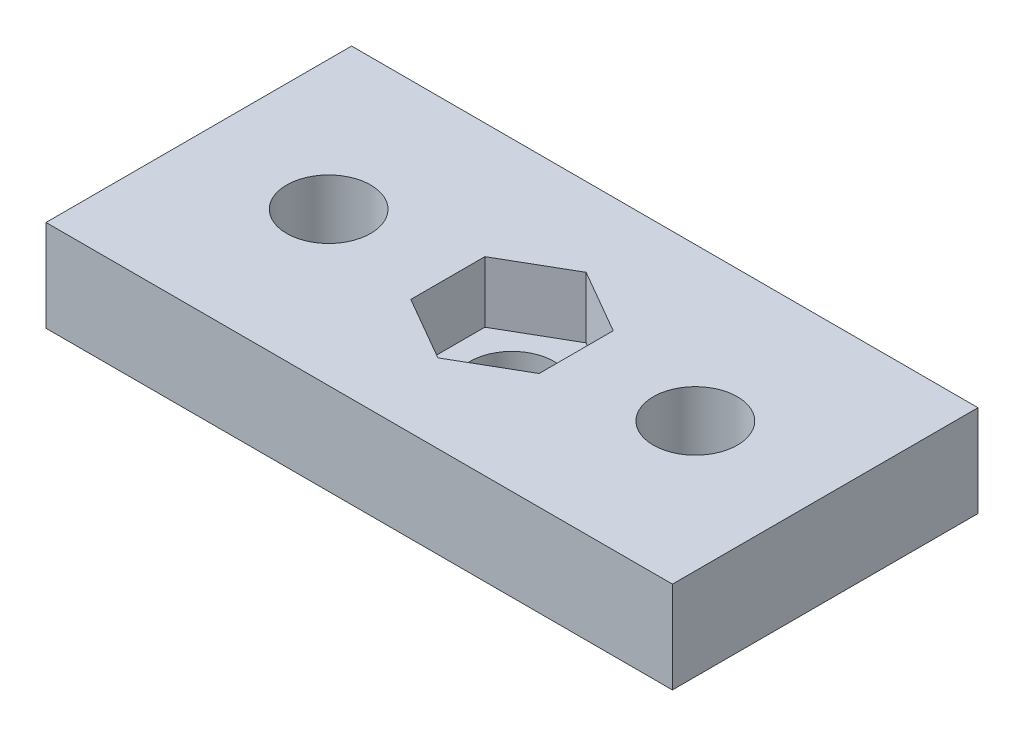
from build123d import *

# Parameters (mm, degrees)
SKETCH1_W           = 41
SKETCH1_H           = 20
BOSS_EXTRUDE1_DEPTH = 6
NUT_DEPTH           = 4
SKETCH7_R           = 2.75
HOLES_DEPTH         = 47.010868281


with BuildPart() as part:
    # Sketch1 → Boss-Extrude1 (new body)
    with BuildSketch(Plane(origin=(0, 0, 0), x_dir=(1, 0, 0), z_dir=(0, 1, 0))):
        with Locations((20.5, 10)):
            Rectangle(SKETCH1_W, SKETCH1_H)
    extrude(amount=-BOSS_EXTRUDE1_DEPTH)

    # Sketch2 → nut (cut)
    with BuildSketch(Plane(origin=(0, 0, 0), x_dir=(1, 0, 0), z_dir=(0, 1, 0))):
        Polygon((20.5, 5.150257739), (24.7, 7.575128869), (24.7, 12.424871131), (20.5, 14.849742261), (16.3, 12.424871131), (16.3, 7.575128869), align=None)
    extrude(amount=-NUT_DEPTH, mode=Mode.SUBTRACT)

    # Sketch7 → holes (cut, through all)
    with BuildSketch(Plane(origin=(0, 0, 0), x_dir=(1, 0, 0), z_dir=(0, 1, 0))):
        with Locations((8.5, 10)):
            Circle(SKETCH7_R)
        with Locations((32.5, 10)):
            Circle(SKETCH7_R)
        with Locations((20.5, 10)):
            Circle(SKETCH7_R)
    extrude(amount=-HOLES_DEPTH, mode=Mode.SUBTRACT)


solid = part.part
